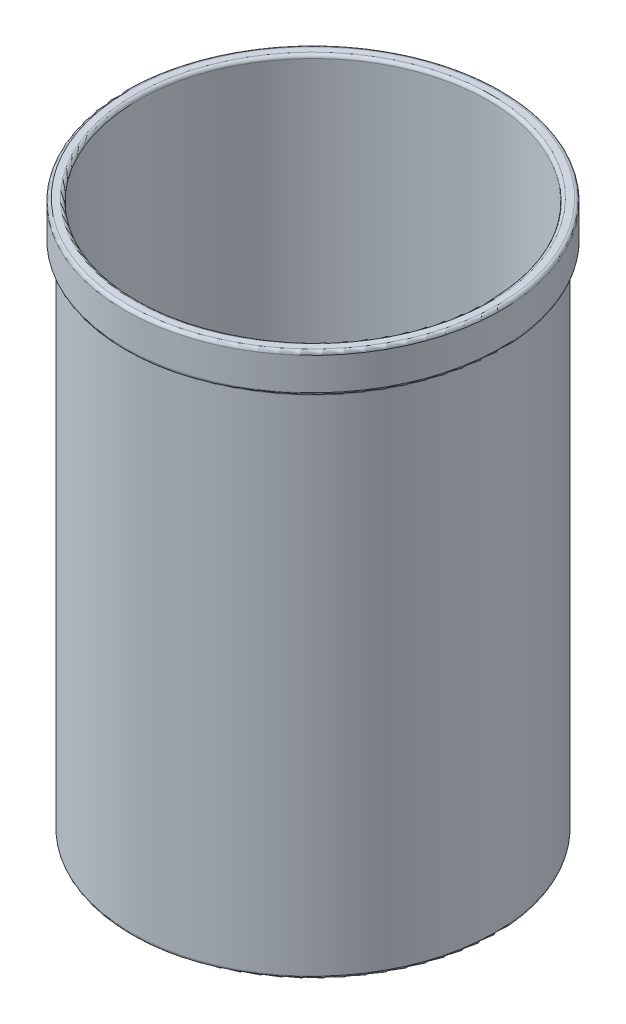
from build123d import *

# Parameters (mm, degrees)
SKETCH1_R           = 56.1
SKETCH1_R_2         = 54.1
BOSS_EXTRUDE1_DEPTH = 169.33
BOSS_EXTRUDE2_START = -12
SKETCH3_R           = 58.1
SKETCH3_R_2         = 56.1
BOSS_EXTRUDE2_DEPTH = 12
FILLET1_R           = 1


with BuildPart() as part:
    # Sketch1 → Boss-Extrude1 (new body)
    with BuildSketch(Plane(origin=(0, 0, 0), x_dir=(1, 0, 0), z_dir=(0, 1, 0))):
        with Locations(Location((0, 0, 0), (0, 0, 270))):
            Circle(SKETCH1_R)
        with Locations(Location((0, 0, 0), (0, 0, 270))):
            Circle(SKETCH1_R_2, mode=Mode.SUBTRACT)
    extrude(amount=BOSS_EXTRUDE1_DEPTH)

    # Sketch3 → Boss-Extrude2 (add)
    with BuildSketch(Plane(origin=(0, 169.33, 0), x_dir=(1, 0, 0), z_dir=(0, 1, 0)).offset(BOSS_EXTRUDE2_START)):
        with Locations(Location((0, 0, 0), (0, 0, 270))):
            Circle(SKETCH3_R)
        with Locations(Location((0, 0, 0), (0, 0, 270))):
            Circle(SKETCH3_R_2, mode=Mode.SUBTRACT)
    extrude(amount=BOSS_EXTRUDE2_DEPTH)

    # Fillet1
    fillet1_edges = [part.edges().sort_by_distance(p)[0] for p in [
        (0, 157.33, -56.1),
        (0, 157.33, -58.1),
        (0, 169.33, -58.1),
        (0, 0, -56.1),
        (0, 0, -54.1),
        (0, 169.33, -54.1),
    ]]
    fillet(fillet1_edges, radius=FILLET1_R - 0.0001)  # a hair under: the kernel refuses the full size


solid = part.part
